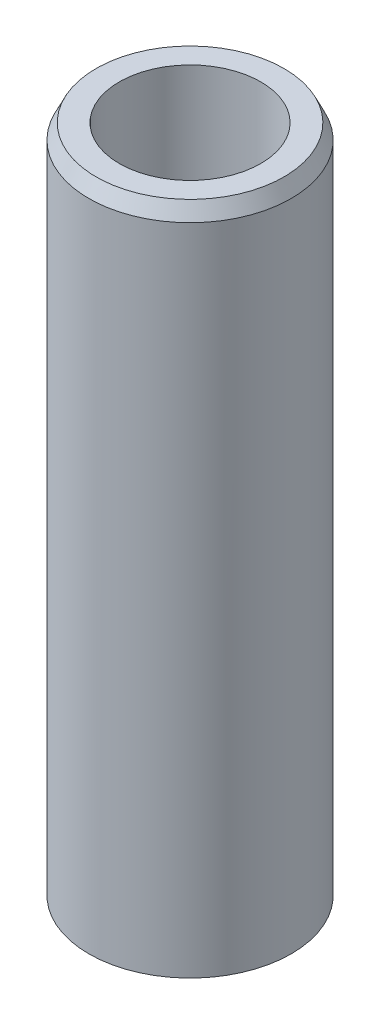
from build123d import *
from OCP.BRepFilletAPI import BRepFilletAPI_MakeChamfer

# Parameters (mm, degrees)
SKETCH1_R           = 25
BOSS_EXTRUDE1_DEPTH = 167.115657347
SKETCH2_R           = 17.483193757
CUT_EXTRUDE1_DEPTH  = 171.814644953
CHAMFER1_SIZE       = 3.722035465
CHAMFER1_SIZE2      = 1.793426879


with BuildPart() as part:
    # Sketch1 → Boss-Extrude1 (new body)
    with BuildSketch(Plane(origin=(0, 0, 0), x_dir=(1, 0, 0), z_dir=(0, 1, 0))):
        Circle(SKETCH1_R)
    extrude(amount=BOSS_EXTRUDE1_DEPTH)

    # Sketch2 → Cut-Extrude1 (cut, through all)
    with BuildSketch(Plane(origin=(0, 0, 0), x_dir=(1, 0, 0), z_dir=(0, 1, 0))):
        Circle(SKETCH2_R)
    extrude(amount=CUT_EXTRUDE1_DEPTH, mode=Mode.SUBTRACT)

    # Chamfer1: one chamfer whose edges measure the first distance from different faces: ONE call of the kernel's chamfer builder (chamfer() names one face for all edges)
    chamfer1_edges_1 = [part.edges().sort_by_distance(p)[0] for p in [
        (-25, 167.115657347, 0),
    ]]
    chamfer1_side_1 = [part.faces().sort_by_distance(p)[0] for p in [
        (-25, 83.557828674, 0),
    ]]
    chamfer1_edges_2 = [part.edges().sort_by_distance(p)[0] for p in [
        (-25, 0, 0),
    ]]
    chamfer1_side_2 = [part.faces().sort_by_distance(p)[0] for p in [
        (-24.292893219, 0, 0),
    ]]
    chamfer1 = BRepFilletAPI_MakeChamfer(part.part.solid().wrapped)
    for e in chamfer1_edges_1:
        chamfer1.Add(CHAMFER1_SIZE, CHAMFER1_SIZE2, e.wrapped, chamfer1_side_1[0].wrapped)  # the first distance lies on this face
    for e in chamfer1_edges_2:
        chamfer1.Add(CHAMFER1_SIZE, CHAMFER1_SIZE2, e.wrapped, chamfer1_side_2[0].wrapped)  # the first distance lies on this face
    add(Compound.cast(chamfer1.Shape()), mode=Mode.REPLACE)


solid = part.part
